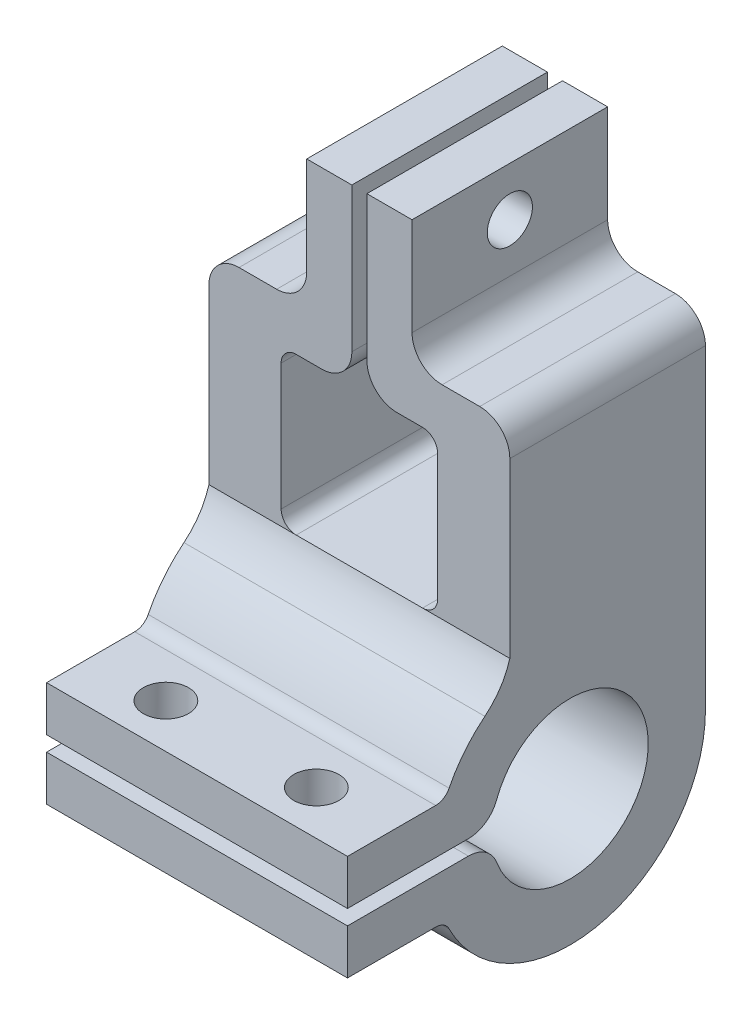
from build123d import *

# Parameters (mm, degrees)
BOSS_EXTRUDE1_DEPTH            = 10
BOSS_EXTRUDE1_DEPTH_BACK       = 10
FILLET1_R                      = 1
BOSS_EXTRUDE2_START            = -10
BOSS_EXTRUDE2_DEPTH            = 20
FILLET2_R                      = 5
BOSS_EXTRUDE3_DEPTH            = 4
BOSS_EXTRUDE3_DEPTH_BACK       = 9
FILLET3_R                      = 1
FILLET4_R                      = 2
CUT_EXTRUDE1_REACH             = 35.208
SKETCH4_R                      = 1.5
CUT_EXTRUDE2_REACH             = 38.208
SKETCH5_R                      = 1.5
CUT_EXTRUDE2_DIRECTION_2_REACH = 38.208
FILLET5_R                      = 2


with BuildPart() as part:
    # Sketch1 → Boss-Extrude1 (new, two sides: drawn at the far end of the back side and taken through both)
    with BuildSketch(Plane(origin=(0, 0, 0), x_dir=(0, 0, -1), z_dir=(1, 0, 0)).offset(-BOSS_EXTRUDE1_DEPTH_BACK)):
        with BuildLine():
            Line((-5.175905718, 0.5), (-14.791561976, 0.5))
            Line((-14.791561976, 0.5), (-14.791561976, 3.5))
            Line((-14.791561976, 3.5), (-8.291561976, 3.5))
            ThreePointArc((-8.291561976, 3.5), (9, 0), (-8.291561976, -3.5))
            Line((-8.291561976, -3.5), (-14.791561976, -3.5))
            Line((-14.791561976, -3.5), (-14.791561976, -0.5))
            Line((-14.791561976, -0.5), (-5.175905718, -0.5))
            ThreePointArc((-5.175905718, -0.5), (5.2, 0), (-5.175905718, 0.5))
        make_face()
    extrude(amount=BOSS_EXTRUDE1_DEPTH + BOSS_EXTRUDE1_DEPTH_BACK)

    # Fillet1
    fillet1_edges = [part.edges().sort_by_distance(p)[0] for p in [
        (0, 3.5, 8.291561976),
        (0, -3.5, 8.291561976),
    ]]
    fillet(fillet1_edges, radius=FILLET1_R)

    # Sketch2 → Boss-Extrude2 (add)
    with BuildSketch(Plane(origin=(0, 0, 0), x_dir=(0, 0, -1), z_dir=(1, 0, 0)).offset(BOSS_EXTRUDE2_START)):
        with BuildLine():
            Line((-4, 8.062257748), (-4, 9.5))
            Line((-4, 9.5), (4, 9.5))
            Line((4, 9.5), (9, 9.5))
            Line((9, 9.5), (9, 0))
            ThreePointArc((9, 0), (7.64852927, 4.74341649), (4, 8.062257748))
            Line((4, 8.062257748), (-4, 8.062257748))
        make_face()
    extrude(amount=BOSS_EXTRUDE2_DEPTH)

    # Fillet2
    # the kernel refuses this fillet: 5 mm, written as the material it adds along each edge
    with BuildSketch(Plane(origin=(-10, 8.062257748, 4), x_dir=(0, -0.5399133181781692, 0.8417206239922121), z_dir=(1, 0, 0))) as fillet2_piece_1:
        with BuildLine():
            CenterArc((2.519874472, -4.969901053), FILLET2_R, 96.289938273, 34.950941651)
            Line((-0.77625619, -1.210177305), (-0.842178803, -1.13498283))
            ThreePointArc((-0.842178803, -1.13498283), (-0.472300157, -0.551097321), (-0.084172062, 0.053991332))
            Line((-0.084172062, 0.053991332), (0.010955976, 0.099398021))
            ThreePointArc((0.010955976, 0.099398021), (0.986037837, 0.045821895), (1.961119698, 0.099398021))
            Line((1.961119698, 0.099398021), (1.972075674, 0))
        make_face()
    extrude(amount=20)

    # Sketch3 → Boss-Extrude3 (add, two sides: drawn at the far end of the back side and taken through both)
    with BuildSketch(Plane.XY.offset(-BOSS_EXTRUDE3_DEPTH_BACK)):
        Polygon((-5.2, 9.5), (-5.2, 19.9), (-0.5, 19.9), (-0.5, 31.5), (-3.5, 31.5), (-3.5, 23), (-10, 23), (-10, 9.5), align=None)
        Polygon((5.2, 19.9), (5.2, 9.5), (10, 9.5), (10, 23), (3.5, 23), (3.5, 31.5), (0.5, 31.5), (0.5, 19.9), align=None)
    extrude(amount=BOSS_EXTRUDE3_DEPTH + BOSS_EXTRUDE3_DEPTH_BACK)

    # Fillet3
    fillet3_edges = [part.edges().sort_by_distance(p)[0] for p in [
        (-5.2, 9.5, -2.5),
        (-5.2, 19.9, -2.5),
        (5.2, 19.9, -2.5),
        (5.2, 9.5, -2.5),
    ]]
    fillet(fillet3_edges, radius=FILLET3_R)

    # Fillet4
    fillet4_edges = [part.edges().sort_by_distance(p)[0] for p in [
        (-3.5, 23, -2.5),
        (-10, 23, -2.5),
        (10, 23, -2.5),
        (3.5, 23, -2.5),
    ]]
    fillet(fillet4_edges, radius=FILLET4_R)

    # Cut-Extrude1: up to this face of the body (flat: up to its plane)
    cut_extrude1_end = Plane(part.part.faces().sort_by_distance((0, -3.5, 11.860923763))[0])
    # Sketch4 → Cut-Extrude1 (cut, up to the picked face)
    with BuildSketch(Plane(origin=(0, 3.5, 0), x_dir=(1, 0, 0), z_dir=(0, 1, 0)), mode=Mode.PRIVATE) as cut_extrude1_sk1:
        with Locations(Location((-5, -11.860923763, 0), (0, 0, 270))):
            Circle(SKETCH4_R)
    cut_extrude1_tool1 = split(extrude(cut_extrude1_sk1.sketch, amount=-CUT_EXTRUDE1_REACH, mode=Mode.PRIVATE), bisect_by=cut_extrude1_end, keep=Keep.BOTH, mode=Mode.PRIVATE)
    # Sketch4 → Cut-Extrude1 (cut, up to the picked face)
    with BuildSketch(Plane(origin=(0, 3.5, 0), x_dir=(1, 0, 0), z_dir=(0, 1, 0)), mode=Mode.PRIVATE) as cut_extrude1_sk2:
        with Locations(Location((5, -11.860923763, 0), (0, 0, 270))):
            Circle(SKETCH4_R)
    cut_extrude1_tool2 = split(extrude(cut_extrude1_sk2.sketch, amount=-CUT_EXTRUDE1_REACH, mode=Mode.PRIVATE), bisect_by=cut_extrude1_end, keep=Keep.BOTH, mode=Mode.PRIVATE)
    add(cut_extrude1_tool1.solids().sort_by(Axis((-5, 3.5, 11.860924), (0, -1, 0)))[0], mode=Mode.SUBTRACT)
    add(cut_extrude1_tool2.solids().sort_by(Axis((5, 3.5, 11.860924), (0, -1, 0)))[0], mode=Mode.SUBTRACT)

    # Cut-Extrude2: up to this face of the body (flat: up to its plane)
    cut_extrude2_end = Plane(part.part.faces().sort_by_distance((-3.5, 28.25, -2.5))[0])
    # Sketch5 → Cut-Extrude2 (cut, up to the picked face)
    with BuildSketch(Plane(origin=(0, 0, 0), x_dir=(0, 0, -1), z_dir=(1, 0, 0)), mode=Mode.PRIVATE) as cut_extrude2_sk1:
        with Locations((2.5, 28.25)):
            Circle(SKETCH5_R)
    cut_extrude2_tool1 = split(extrude(cut_extrude2_sk1.sketch, amount=-CUT_EXTRUDE2_REACH, mode=Mode.PRIVATE), bisect_by=cut_extrude2_end, keep=Keep.BOTH, mode=Mode.PRIVATE)
    add(cut_extrude2_tool1.solids().sort_by(Axis((0, 28.25, -2.5), (-1, 0, 0)))[0], mode=Mode.SUBTRACT)

    # Cut-Extrude2 direction 2: up to this face of the body (flat: up to its plane)
    cut_extrude2_direction_2_end = Plane(part.part.faces().sort_by_distance((3.5, 28.25, -2.5))[0])
    # Sketch5 → Cut-Extrude2 direction 2 (cut, up to the picked face)
    with BuildSketch(Plane(origin=(0, 0, 0), x_dir=(0, 0, -1), z_dir=(1, 0, 0)), mode=Mode.PRIVATE) as cut_extrude2_direction_2_sk1:
        with Locations((2.5, 28.25)):
            Circle(SKETCH5_R)
    cut_extrude2_direction_2_tool1 = split(extrude(cut_extrude2_direction_2_sk1.sketch, amount=CUT_EXTRUDE2_DIRECTION_2_REACH, mode=Mode.PRIVATE), bisect_by=cut_extrude2_direction_2_end, keep=Keep.BOTH, mode=Mode.PRIVATE)
    add(cut_extrude2_direction_2_tool1.solids().sort_by(Axis((0, 28.25, -2.5), (1, 0, 0)))[0], mode=Mode.SUBTRACT)

    # Fillet5
    fillet5_edges = [part.edges().sort_by_distance(p)[0] for p in [
        (0, 0.5, 5.175905718),
        (0, -0.5, 5.175905718),
        (-0.5, 19.9, -2.5),
        (0.5, 19.9, -2.5),
    ]]
    fillet(fillet5_edges, radius=FILLET5_R)


solid = part.part
